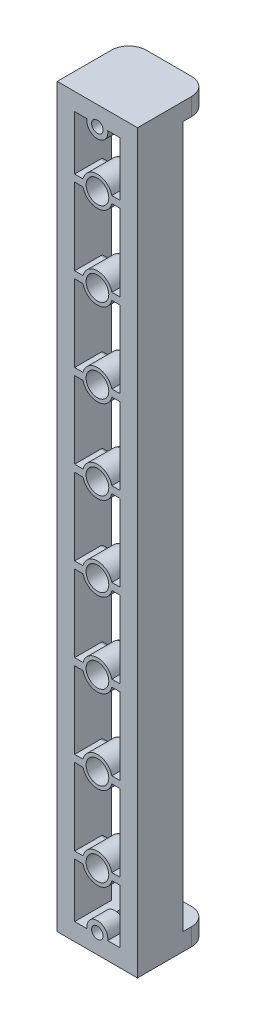
from build123d import *

# Parameters (mm, degrees)
SKETCH1_W              = 23
SKETCH1_H              = 211
SKETCH1_W_2            = 13
SKETCH1_H_2            = 201
BOSS_EXTRUDE1_DEPTH    = 13
SKETCH7_R              = 4.25
SKETCH7_R_2            = 3.25
SKETCH7_W              = 4
SKETCH7_H              = 2
BOSS_EXTRUDE5_DEPTH    = 8.5
FILLET4_R              = 1
LPATTERN7_COUNT        = 8
LPATTERN7_PITCH        = 24
FILLET4_OF_LPATTERN7_R = 1
SKETCH15_W             = 23
SKETCH15_H             = 13
BOSS_EXTRUDE8_DEPTH    = 5
SKETCH22_W             = 23
SKETCH22_H             = 5
CUT_EXTRUDE9_DEPTH     = 112.854816615
SKETCH23_W             = 23
SKETCH23_H             = 5
BOSS_EXTRUDE9_DEPTH    = 7.5
FILLET8_R              = 5
CUT_EXTRUDE11_START    = -5
CUT_EXTRUDE11_DEPTH    = 201
SKETCH26_R             = 3
BOSS_EXTRUDE10_DEPTH   = 5
SKETCH27_R             = 1.65
CUT_EXTRUDE12_DEPTH    = 109.086770698
SKETCH28_R             = 3
CUT_EXTRUDE13_DEPTH    = 24


with BuildPart() as part:
    # Sketch1 → Boss-Extrude1 (new body)
    with BuildSketch(Plane.XY):
        Rectangle(SKETCH1_W, SKETCH1_H)
        Rectangle(SKETCH1_W_2, SKETCH1_H_2, mode=Mode.SUBTRACT)
    extrude(amount=BOSS_EXTRUDE1_DEPTH)

    # Sketch7 → Boss-Extrude5 (add)
    # profile 1 of 3: a face of its own
    with BuildSketch(Plane.XY.offset(13)):
        with Locations((0.023652706, 84)):
            Circle(SKETCH7_R)
        with Locations((0.023652706, 84)):
            Circle(SKETCH7_R_2, mode=Mode.SUBTRACT)
    # profile 2 of 3: a face of its own
    with BuildSketch(Plane.XY.offset(13)):
        with Locations((-5.395766476, 84)):
            Rectangle(SKETCH7_W, SKETCH7_H)
    # profile 3 of 3: a face of its own
    with BuildSketch(Plane.XY.offset(13)):
        with Locations((5.443071887, 84)):
            Rectangle(SKETCH7_W, SKETCH7_H)
    boss_extrude5 = extrude(amount=-BOSS_EXTRUDE5_DEPTH)

    # Fillet4
    fillet4_edges = [part.edges().sort_by_distance(p)[0] for p in [
        (-5.303512602, 83, 4.5),
        (5.327165308, 85, 4.5),
        (-5.303512602, 85, 4.5),
        (0.023652706, 88.25, 4.5),
        (5.327165308, 83, 4.5),
        (0.023652706, 79.75, 4.5),
    ]]
    fillet(fillet4_edges, radius=FILLET4_R - 0.0001)  # a hair under: the kernel refuses the full size

    # LPattern7: Boss-Extrude5 ×8
    with Locations(*[(0, -i * LPATTERN7_PITCH, 0) for i in range(1, LPATTERN7_COUNT)]):
        add(boss_extrude5)

    # Fillet4 of LPattern7
    fillet4_of_lpattern7_edges = [part.edges().sort_by_distance(p)[0] for p in [
        (-5.303512602, 59, 4.5),
        (5.327165308, 61, 4.5),
        (-5.303512602, 61, 4.5),
        (0.023652706, 64.25, 4.5),
        (5.327165308, 59, 4.5),
        (0.023652706, 55.75, 4.5),
        (-5.303512602, 35, 4.5),
        (5.327165308, 37, 4.5),
        (-5.303512602, 37, 4.5),
        (0.023652706, 40.25, 4.5),
        (5.327165308, 35, 4.5),
        (0.023652706, 31.75, 4.5),
        (-5.303512602, 11, 4.5),
        (5.327165308, 13, 4.5),
        (-5.303512602, 13, 4.5),
        (0.023652706, 16.25, 4.5),
        (5.327165308, 11, 4.5),
        (0.023652706, 7.75, 4.5),
        (-5.303512602, -13, 4.5),
        (5.327165308, -11, 4.5),
        (-5.303512602, -11, 4.5),
        (0.023652706, -7.75, 4.5),
        (5.327165308, -13, 4.5),
        (0.023652706, -16.25, 4.5),
        (-5.303512602, -37, 4.5),
        (5.327165308, -35, 4.5),
        (-5.303512602, -35, 4.5),
        (0.023652706, -31.75, 4.5),
        (5.327165308, -37, 4.5),
        (0.023652706, -40.25, 4.5),
        (-5.303512602, -61, 4.5),
        (5.327165308, -59, 4.5),
        (-5.303512602, -59, 4.5),
        (0.023652706, -55.75, 4.5),
        (5.327165308, -61, 4.5),
        (0.023652706, -64.25, 4.5),
        (-5.303512602, -85, 4.5),
        (5.327165308, -83, 4.5),
        (-5.303512602, -83, 4.5),
        (0.023652706, -79.75, 4.5),
        (5.327165308, -85, 4.5),
        (0.023652706, -88.25, 4.5),
    ]]
    fillet(fillet4_of_lpattern7_edges, radius=FILLET4_OF_LPATTERN7_R - 0.0001)  # a hair under: the kernel refuses the full size

    # Sketch15 → Boss-Extrude8 (add)
    with BuildSketch(Plane(origin=(0, 105.5, 0), x_dir=(1, 0, 0), z_dir=(0, 1, 0))):
        with Locations((0, -6.5)):
            Rectangle(SKETCH15_W, SKETCH15_H)
    boss_extrude8 = extrude(amount=BOSS_EXTRUDE8_DEPTH)

    # Mirror5: Boss-Extrude8 across plane
    add(boss_extrude8.mirror(Plane.ZX))

    # Sketch22 → Cut-Extrude9 (cut, through all)
    with BuildSketch(Plane(origin=(0, 0, 0), x_dir=(-1, 0, 0), z_dir=(0, 0, -1))):
        with Locations((0, 108)):
            Rectangle(SKETCH22_W, SKETCH22_H)
        with Locations((0, -108)):
            Rectangle(SKETCH22_W, SKETCH22_H)
    extrude(amount=-CUT_EXTRUDE9_DEPTH, mode=Mode.SUBTRACT)

    # Sketch23 → Boss-Extrude9 (add)
    with BuildSketch(Plane(origin=(0, 0, 0), x_dir=(-1, 0, 0), z_dir=(0, 0, -1))):
        with Locations((0, 103)):
            Rectangle(SKETCH23_W, SKETCH23_H)
        with Locations((0, -103)):
            Rectangle(SKETCH23_W, SKETCH23_H)
    extrude(amount=BOSS_EXTRUDE9_DEPTH)

    # Fillet8
    fillet8_edges = [part.edges().sort_by_distance(p)[0] for p in [
        (11.5, 103, -7.5),
        (-11.5, 103, -7.5),
        (11.5, -103, -7.5),
        (-11.5, -103, -7.5),
    ]]
    fillet(fillet8_edges, radius=FILLET8_R)

    # Sketch25 → Cut-Extrude11 (cut)
    with BuildSketch(Plane.XZ.offset(105.5).offset(CUT_EXTRUDE11_START)):
        with BuildLine():
            Line((-9, -0.5), (-6, -0.5))
            Line((-6, -0.5), (-6, 2.5))
            ThreePointArc((-6, 2.5), (-8.121320344, 1.621320344), (-9, -0.5))
        make_face()
        with BuildLine():
            Line((6, -0.5), (6, 2.5))
            ThreePointArc((6, 2.5), (8.121320344, 1.621320344), (9, -0.5))
            Line((9, -0.5), (6, -0.5))
        make_face()
    extrude(amount=-CUT_EXTRUDE11_DEPTH, mode=Mode.SUBTRACT)

    # Sketch26 → Boss-Extrude10 (add)
    with BuildSketch(Plane.XY.offset(13)):
        with Locations((0, -100)):
            Circle(SKETCH26_R)
        with Locations((0, 100)):
            Circle(SKETCH26_R)
    extrude(amount=-BOSS_EXTRUDE10_DEPTH)

    # Sketch27 → Cut-Extrude12 (cut, through all)
    with BuildSketch(Plane.XY.offset(13)):
        with Locations((0, -100)):
            Circle(SKETCH27_R)
        with Locations((0, 100)):
            Circle(SKETCH27_R)
    extrude(amount=-CUT_EXTRUDE12_DEPTH, mode=Mode.SUBTRACT)

    # Sketch28 → Cut-Extrude13 (cut)
    with BuildSketch(Plane(origin=(0, 0, 8), x_dir=(-1, 0, 0), z_dir=(0, 0, -1))):
        with Locations((0, 100)):
            Circle(SKETCH28_R)
        with Locations((0, -100)):
            Circle(SKETCH28_R)
    extrude(amount=CUT_EXTRUDE13_DEPTH, mode=Mode.SUBTRACT)


solid = part.part
